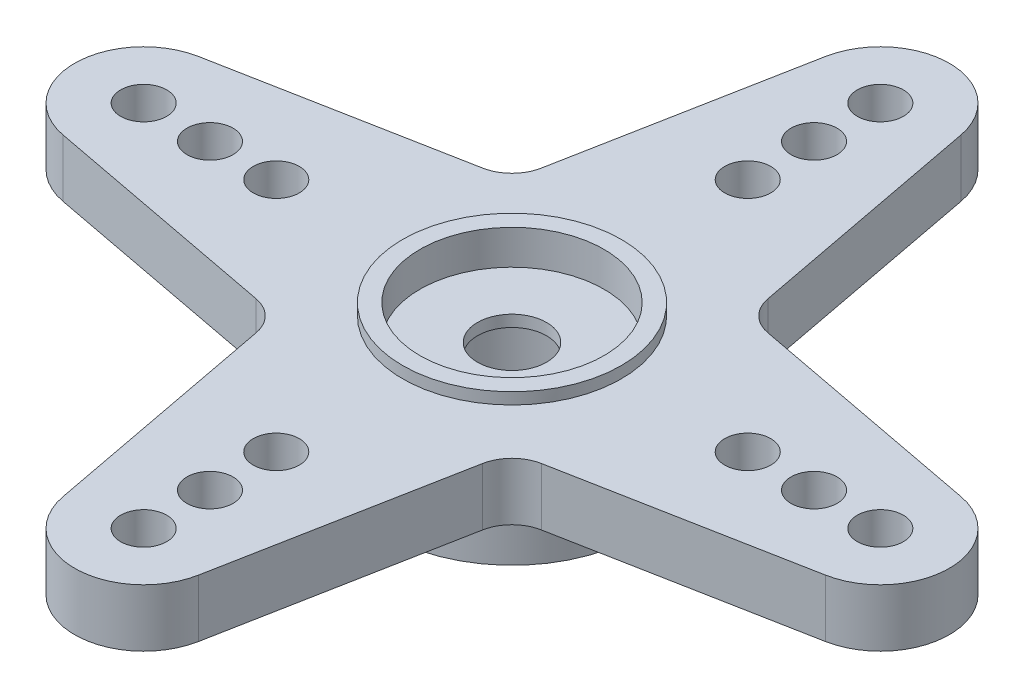
from build123d import *

# Parameters (mm, degrees)
SKETCH1_R           = 1.190625
SKETCH1_R_2         = 0.79375
BOSS_EXTRUDE1_DEPTH = 1.984375
SKETCH2_R           = 3.175
CUT_EXTRUDE1_DEPTH  = 0.79375
SKETCH3_R           = 4.365625
BOSS_EXTRUDE2_DEPTH = 2.38125
SKETCH4_R           = 2.778125
CUT_EXTRUDE2_DEPTH  = 3.175
BOSS_EXTRUDE3_START = 0.396875
SKETCH5_R           = 3.7703125
SKETCH5_R_2         = 3.175
BOSS_EXTRUDE3_DEPTH = 0.396875


with BuildPart() as part:
    # Sketch1 → Boss-Extrude1 (new body)
    with BuildSketch(Plane(origin=(0, 0, 0), x_dir=(1, 0, 0), z_dir=(0, 1, 0))):
        with BuildLine():
            Line((-3.904422951, 4.914801854), (-2.339326011, 13.144865569))
            ThreePointArc((-2.339326011, 13.144865569), (0, 15.08125), (2.339326011, 13.144865569))
            Line((2.339326011, 13.144865569), (3.904422951, 4.914801854))
            ThreePointArc((3.904422951, 4.914801854), (4.254037879, 4.254037879), (4.914801854, 3.904422951))
            Line((4.914801854, 3.904422951), (13.144865569, 2.339326011))
            ThreePointArc((13.144865569, 2.339326011), (15.08125, 0), (13.144865569, -2.339326011))
            Line((13.144865569, -2.339326011), (4.914801854, -3.904422951))
            ThreePointArc((4.914801854, -3.904422951), (4.254037879, -4.254037879), (3.904422951, -4.914801854))
            Line((3.904422951, -4.914801854), (2.339326011, -13.144865569))
            ThreePointArc((2.339326011, -13.144865569), (0, -15.08125), (-2.339326011, -13.144865569))
            Line((-2.339326011, -13.144865569), (-3.904422951, -4.914801854))
            ThreePointArc((-3.904422951, -4.914801854), (-4.254037879, -4.254037879), (-4.914801854, -3.904422951))
            Line((-4.914801854, -3.904422951), (-13.144865569, -2.339326011))
            ThreePointArc((-13.144865569, -2.339326011), (-15.08125, 0), (-13.144865569, 2.339326011))
            Line((-13.144865569, 2.339326011), (-4.914801854, 3.904422951))
            ThreePointArc((-4.914801854, 3.904422951), (-4.254037879, 4.254037879), (-3.904422951, 4.914801854))
        make_face()
        Circle(SKETCH1_R, mode=Mode.SUBTRACT)
        with Locations((0, 12.7)):
            Circle(SKETCH1_R_2, mode=Mode.SUBTRACT)
        with Locations((0, 10.414)):
            Circle(SKETCH1_R_2, mode=Mode.SUBTRACT)
        with Locations((0, 8.128)):
            Circle(SKETCH1_R_2, mode=Mode.SUBTRACT)
        with Locations((12.7, 0)):
            Circle(SKETCH1_R_2, mode=Mode.SUBTRACT)
        with Locations((10.414, 0)):
            Circle(SKETCH1_R_2, mode=Mode.SUBTRACT)
        with Locations((8.128, 0)):
            Circle(SKETCH1_R_2, mode=Mode.SUBTRACT)
        with Locations((0, -12.7)):
            Circle(SKETCH1_R_2, mode=Mode.SUBTRACT)
        with Locations((0, -10.414)):
            Circle(SKETCH1_R_2, mode=Mode.SUBTRACT)
        with Locations((0, -8.128)):
            Circle(SKETCH1_R_2, mode=Mode.SUBTRACT)
        with Locations((-12.7, 0)):
            Circle(SKETCH1_R_2, mode=Mode.SUBTRACT)
        with Locations((-10.414, 0)):
            Circle(SKETCH1_R_2, mode=Mode.SUBTRACT)
        with Locations((-8.128, 0)):
            Circle(SKETCH1_R_2, mode=Mode.SUBTRACT)
    extrude(amount=BOSS_EXTRUDE1_DEPTH)

    # Sketch2 → Cut-Extrude1 (cut)
    with BuildSketch(Plane(origin=(0, 1.984375, 0), x_dir=(1, 0, 0), z_dir=(0, 1, 0))):
        Circle(SKETCH2_R)
    extrude(amount=-CUT_EXTRUDE1_DEPTH, mode=Mode.SUBTRACT)

    # Sketch3 → Boss-Extrude2 (add)
    with BuildSketch(Plane.XZ):
        Circle(SKETCH3_R)
    extrude(amount=BOSS_EXTRUDE2_DEPTH)

    # Sketch4 → Cut-Extrude2 (cut)
    with BuildSketch(Plane.XZ.offset(2.38125)):
        Circle(SKETCH4_R)
    extrude(amount=-CUT_EXTRUDE2_DEPTH, mode=Mode.SUBTRACT)

    # Sketch5 → Boss-Extrude3 (add)
    with BuildSketch(Plane(origin=(0, 1.984375, 0), x_dir=(1, 0, 0), z_dir=(0, 1, 0)).offset(BOSS_EXTRUDE3_START)):
        Circle(SKETCH5_R)
        Circle(SKETCH5_R_2, mode=Mode.SUBTRACT)
    extrude(amount=-BOSS_EXTRUDE3_DEPTH)


solid = part.part
